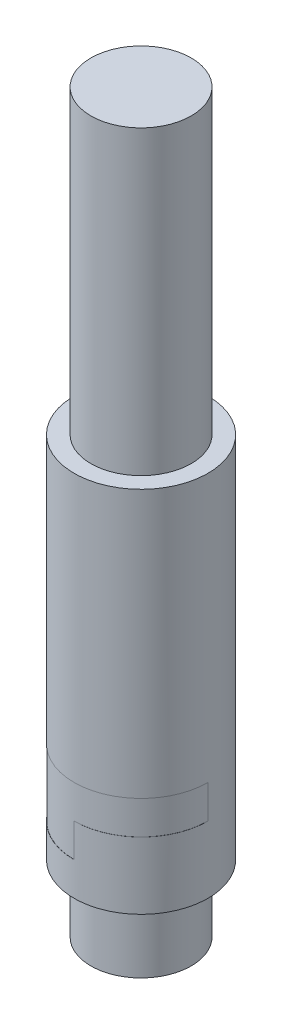
from build123d import *

# Parameters (mm, degrees)
SKETCH1_R           = 9.525
BOSS_EXTRUDE1_DEPTH = 57.15
SKETCH2_R           = 12.7
BOSS_EXTRUDE2_DEPTH = 69.85
BOSS_EXTRUDE3_START = 12.7
SKETCH3_R           = 9.525
BOSS_EXTRUDE3_DEPTH = 12.7
CUT_EXTRUDE1_START  = -6.35
CUT_EXTRUDE1_DEPTH  = 6.35
CUT_EXTRUDE2_START  = -6.35
CUT_EXTRUDE2_DEPTH  = 6.35


with BuildPart() as part:
    # Sketch1 → Boss-Extrude1 (new body)
    with BuildSketch(Plane(origin=(0, 0, 0), x_dir=(1, 0, 0), z_dir=(0, 1, 0))):
        Circle(SKETCH1_R)
    extrude(amount=BOSS_EXTRUDE1_DEPTH)

    # Sketch2 → Boss-Extrude2 (add)
    with BuildSketch(Plane.XZ):
        Circle(SKETCH2_R)
    extrude(amount=BOSS_EXTRUDE2_DEPTH)

    # Sketch3 → Boss-Extrude3 (add)
    with BuildSketch(Plane.XZ.offset(69.85).offset(BOSS_EXTRUDE3_START)):
        Circle(SKETCH3_R)
    extrude(amount=-BOSS_EXTRUDE3_DEPTH)

    # Sketch4 → Cut-Extrude1 (cut)
    with BuildSketch(Plane(origin=(0, -63.5, 0), x_dir=(-1, 0, 0), z_dir=(0, -1, 0)).offset(CUT_EXTRUDE1_START)):
        with BuildLine():
            Line((0, 12.7), (0, 12.6746))
            ThreePointArc((0, 12.6746), (12.6746, 0), (0, -12.6746))
            Line((0, -12.6746), (0, -12.7))
            ThreePointArc((0, -12.7), (12.7, 0), (0, 12.7))
        make_face()
    extrude(amount=CUT_EXTRUDE1_DEPTH, mode=Mode.SUBTRACT)

    # Sketch5 → Cut-Extrude2 (cut)
    with BuildSketch(Plane.XZ.offset(57.15).offset(CUT_EXTRUDE2_START)):
        with BuildLine():
            Line((-12.7, 0), (-12.6746, 0))
            ThreePointArc((-12.6746, 0), (0, 12.6746), (12.6746, 0))
            Line((12.6746, 0), (12.7, 0))
            ThreePointArc((12.7, 0), (0, 12.7), (-12.7, 0))
        make_face()
    extrude(amount=CUT_EXTRUDE2_DEPTH, mode=Mode.SUBTRACT)


solid = part.part
